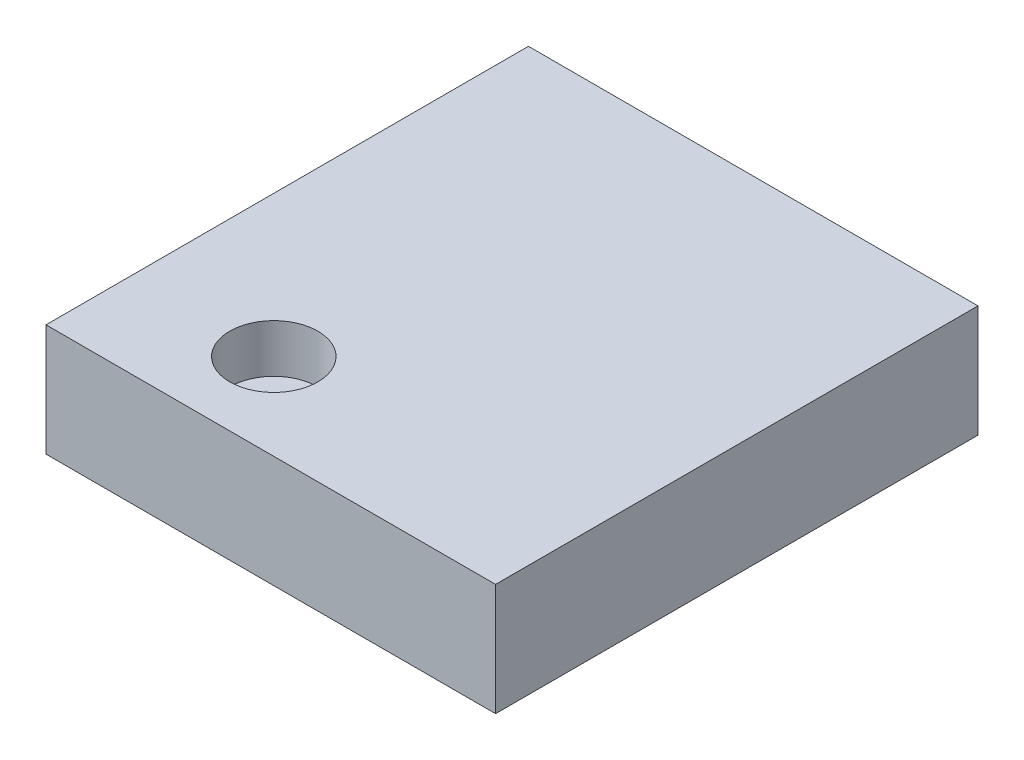
from build123d import *

# Parameters (mm, degrees)
SKETCH1_W           = 93.187532809
SKETCH1_H           = 23.215981166
BOSS_EXTRUDE1_DEPTH = 100
SKETCH2_R           = 9.124505791
CUT_EXTRUDE1_DEPTH  = 10


with BuildPart() as part:
    # Sketch1 → Boss-Extrude1 (new body)
    with BuildSketch(Plane.XY):
        with Locations((46.593766405, 11.607990583)):
            Rectangle(SKETCH1_W, SKETCH1_H)
    extrude(amount=BOSS_EXTRUDE1_DEPTH)

    # Sketch2 → Cut-Extrude1 (cut)
    with BuildSketch(Plane(origin=(0, 23.215981166, 0), x_dir=(1, 0, 0), z_dir=(0, 1, 0))):
        with Locations((29.301766667, -82.079947659)):
            Circle(SKETCH2_R)
    extrude(amount=-CUT_EXTRUDE1_DEPTH, mode=Mode.SUBTRACT)


solid = part.part
